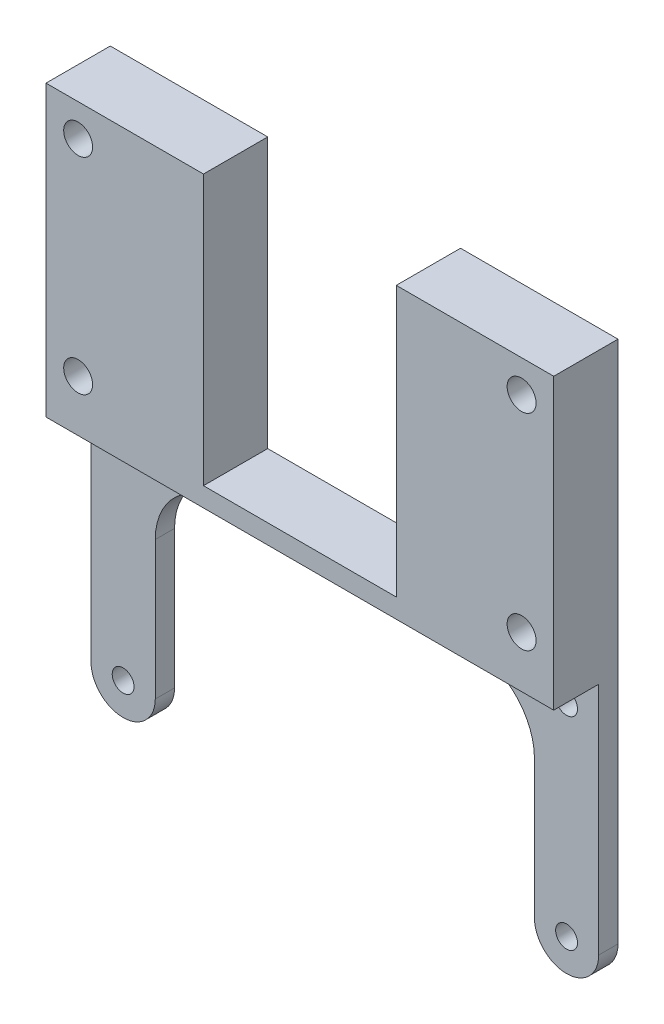
from build123d import *

# Parameters (mm, degrees)
BOSS_EXTRUDE1_DEPTH  = 3
FILLET1_R            = 10
FILLET2_R            = 5
M3_CLEARANCE_HOLE1_D = 3.4
BOSS_EXTRUDE3_DEPTH  = 10
M4_CLEARANCE_HOLE1_D = 4.5


with BuildPart() as part:
    # Sketch1 → Boss-Extrude1 (new body)
    with BuildSketch(Plane.XY):
        Polygon((28.024558014, 7.846809304), (28.024558014, -28.653190696), (38.024558014, -28.653190696), (38.024558014, 12.846809304), (-40.975441986, 12.846809304), (-40.975441986, -28.653190696), (-30.975441986, -28.653190696), (-30.975441986, 7.846809304), align=None)
    extrude(amount=BOSS_EXTRUDE1_DEPTH)

    # Fillet1
    fillet1_edges = [part.edges().sort_by_distance(p)[0] for p in [
        (28.024558014, 7.846809304, 1.5),
        (-30.975441986, 7.846809304, 1.5),
    ]]
    fillet(fillet1_edges, radius=FILLET1_R)

    # Fillet2
    fillet2_edges = [part.edges().sort_by_distance(p)[0] for p in [
        (-30.975441986, -28.653190696, 1.5),
        (-40.975441986, -28.653190696, 1.5),
        (28.024558014, -28.653190696, 1.5),
        (38.024558014, -28.653190696, 1.5),
    ]]
    fillet(fillet2_edges, radius=FILLET2_R - 0.0001)  # a hair under: the kernel refuses the full size

    # M3 Clearance Hole1 (through all)
    with Locations(Plane(origin=(0, 0, 0), x_dir=(-1, 0, 0), z_dir=(0, 0, -1))):
        with Locations((-33.024558014, 7.846809304), (35.975441986, -23.653190696), (35.975441986, 7.846809304), (-33.024558014, -23.653190696)):
            Hole(M3_CLEARANCE_HOLE1_D / 2)

    # Sketch5 → Boss-Extrude3 (add)
    with BuildSketch(Plane(origin=(0, 0, 0), x_dir=(-1, 0, 0), z_dir=(0, 0, -1))):
        Polygon((-38.024558014, 57.846809304), (-38.024558014, 12.846809304), (40.975441986, 12.846809304), (40.975441986, 57.846809304), (16.475441986, 57.846809304), (16.475441986, 15.846809304), (-13.524558014, 15.846809304), (-13.524558014, 57.846809304), align=None)
    extrude(amount=-BOSS_EXTRUDE3_DEPTH)

    # M4 Clearance Hole1 (through all)
    with Locations(Plane(origin=(0, 0, 0), x_dir=(-1, 0, 0), z_dir=(0, 0, -1))):
        with Locations((-33.024558014, 52.846809304), (-33.024558014, 20.846809304), (35.975441986, 20.846809304), (35.975441986, 52.846809304)):
            Hole(M4_CLEARANCE_HOLE1_D / 2)


solid = part.part
